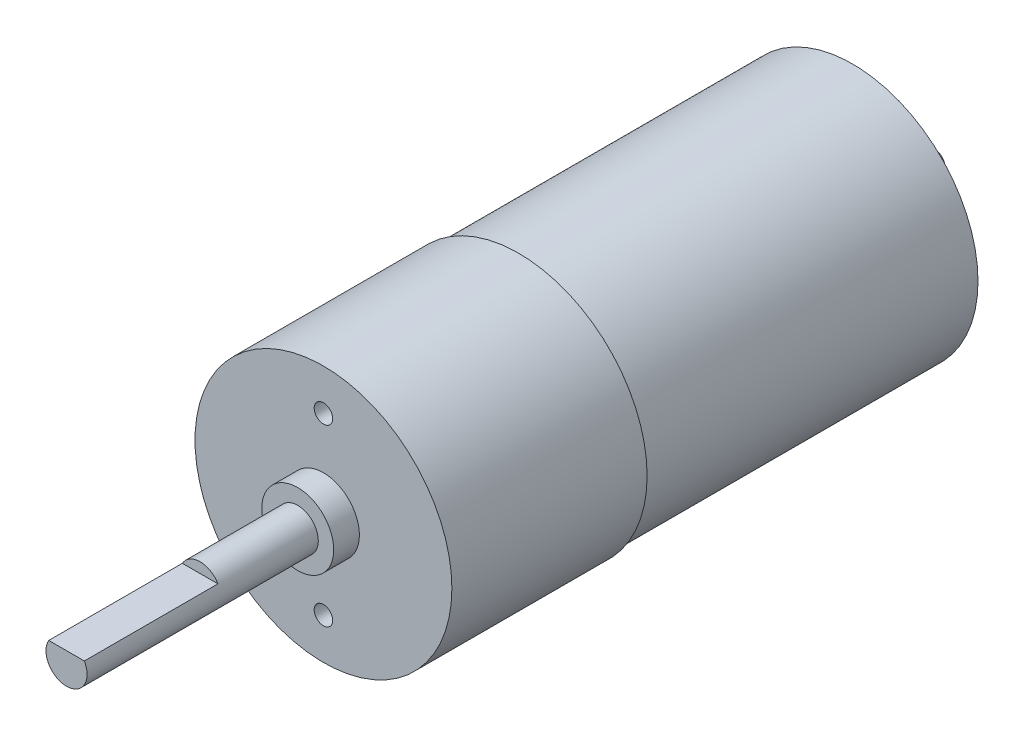
from build123d import *

# Parameters (mm, degrees)
SKETCH_1_R          = 12.5
EXTRUDE_1_DEPTH     = 19
SKETCH_2_R          = 3.5
EXTRUDE_2_DEPTH     = 2.5
SKETCH_3_R          = 2
EXTRUDE_3_DEPTH     = 22.5
SKETCH_4_W          = 6.562487183
SKETCH_4_H          = 1.182107807
CUT_EXTRUDE_1_DEPTH = 13
SKETCH_5_R          = 12.2
EXTRUDE_5_DEPTH     = 32.5
EXTRUDE_START       = 3
SKETCH_6_R          = 3.5
EXTRUDE_6_DEPTH     = 3
SKETCH_7_R          = 1
EXTRUDE_7_DEPTH     = 5
SKETCH_8_R          = 0.9
CUT_EXTRUDE_2_DEPTH = 5


with BuildPart() as part:
    # 스케치1 → 보스-돌출1 (new body)
    with BuildSketch(Plane.XY):
        Circle(SKETCH_1_R)
    extrude(amount=EXTRUDE_1_DEPTH)

    # 스케치2 → 보스-돌출2 (add)
    with BuildSketch(Plane.XY.offset(19)):
        Circle(SKETCH_2_R)
    extrude(amount=EXTRUDE_2_DEPTH)

    # 스케치3 → 보스-돌출3 (add)
    with BuildSketch(Plane.XY.offset(21.5)):
        Circle(SKETCH_3_R)
    extrude(amount=EXTRUDE_3_DEPTH)

    # 스케치4 → 컷-돌출1 (cut)
    with BuildSketch(Plane.XY.offset(44)):
        with Locations((0.048491285, 1.591053903)):
            Rectangle(SKETCH_4_W, SKETCH_4_H)
    extrude(amount=-CUT_EXTRUDE_1_DEPTH, mode=Mode.SUBTRACT)

    # 스케치5 → 보스-돌출5 (add)
    with BuildSketch(Plane(origin=(0, 0, 0), x_dir=(-1, 0, 0), z_dir=(0, 0, -1))):
        Circle(SKETCH_5_R)
    extrude(amount=EXTRUDE_5_DEPTH)

    # 스케치6 → 보스-돌출6 (add)
    with BuildSketch(Plane(origin=(0, 0, -32.5), x_dir=(-1, 0, 0), z_dir=(0, 0, -1)).offset(EXTRUDE_START)):
        Circle(SKETCH_6_R)
    extrude(amount=-EXTRUDE_6_DEPTH)

    # 스케치7 → 보스-돌출7 (add)
    with BuildSketch(Plane(origin=(0, 0, -35.5), x_dir=(-1, 0, 0), z_dir=(0, 0, -1))):
        Circle(SKETCH_7_R)
    extrude(amount=EXTRUDE_7_DEPTH)

    # 스케치8 → 컷-돌출2 (cut)
    with BuildSketch(Plane.XY.offset(19)):
        with Locations((0, 8.5)):
            Circle(SKETCH_8_R)
        with Locations((0, -8.5)):
            Circle(SKETCH_8_R)
    extrude(amount=-CUT_EXTRUDE_2_DEPTH, mode=Mode.SUBTRACT)


solid = part.part
